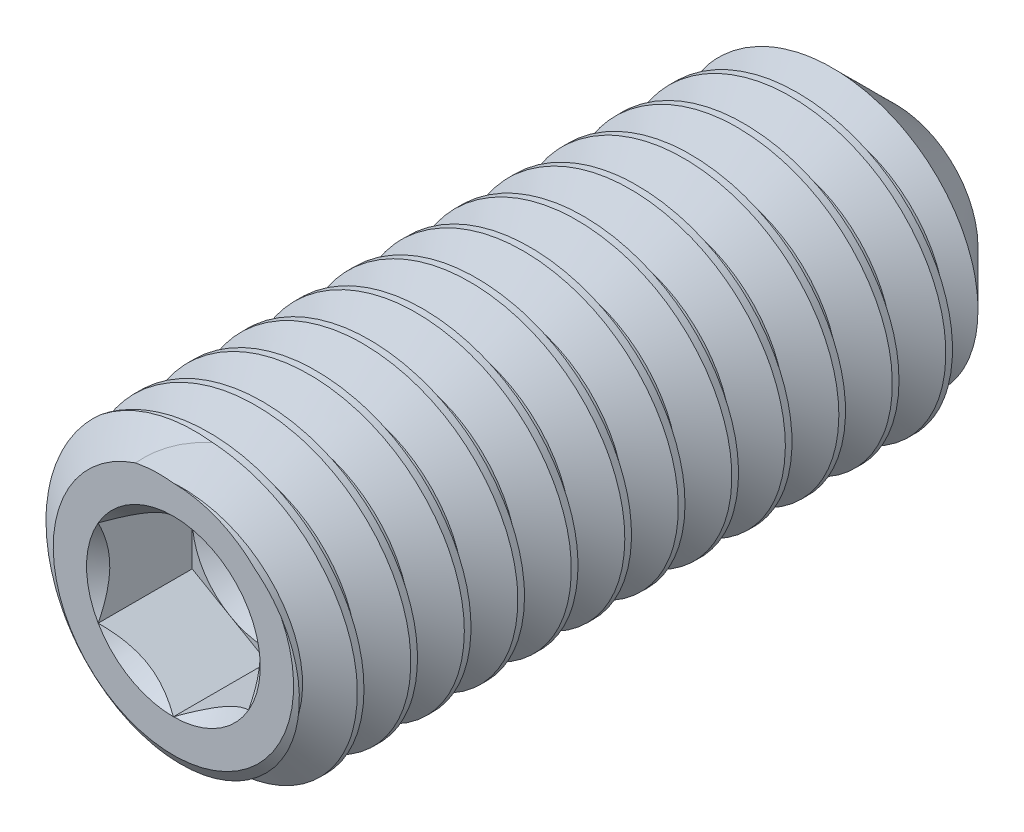
from build123d import *

# Parameters (mm, degrees)
CUT_EXTRUDE10_DEPTH = 2.48046875
CUT_SWEEP1_PITCH    = 1.411111111


with BuildPart() as part:
    # Sketch22 → Revolve1 (revolve)
    with BuildSketch(Plane(origin=(0, 0, 0), x_dir=(0, 0, -1), z_dir=(1, 0, 0)), mode=Mode.PRIVATE) as revolve1_sk:
        Polygon((-8.872688844, 0), (-8.872688844, 3.16992), (-8.317788375, 3.9624), (8.3861673, 3.9624), (10.177311156, 2.171256145), (8.872688844, 0), align=None)
    revolve(revolve1_sk.sketch.rotate(Axis((0, 0, -8.872688844), (0, 0, -1)), 180), axis=Axis((0, 0, -8.872688844), (0, 0, -1)))

    # Sketch23 → Cut-Extrude10 (cut)
    with BuildSketch(Plane.XY.offset(8.872688844)):
        Polygon((0, 2.291358881), (-1.984375, 1.14567944), (-1.984375, -1.14567944), (0, -2.291358881), (1.984375, -1.14567944), (1.984375, 1.14567944), align=None)
    extrude(amount=-CUT_EXTRUDE10_DEPTH, mode=Mode.SUBTRACT)

    # Cut-Extrude11 cone 1 section (through the dimple's axis) → Cut-Extrude11 (revolve, cut)
    with BuildSketch(Plane(origin=(0, 0, 8.872688844), x_dir=(0, -1, 0), z_dir=(1, 0, 0))):
        Polygon((0, 0), (2.291358881, 0), (0, 2.291358881), align=None)
    revolve(axis=Axis((0, 0, 8.872688844), (0, 0, -1)), mode=Mode.SUBTRACT)

    # Cut-Extrude12 cone 1 section (through the dimple's axis) → Cut-Extrude12 (revolve, cut)
    with BuildSketch(Plane(origin=(0, 0, 6.392220094), x_dir=(0, -1, 0), z_dir=(1, 0, 0))):
        Polygon((0, 0), (1.984375, 0), (0, 1.14567944), align=None)
    revolve(axis=Axis((0, 0, 6.392220094), (0, 0, -1)), mode=Mode.SUBTRACT)

    # Cut-Sweep1: the profile of Sketch32 screwed along a right-hand helix of 14.5 turns, 8 arcs to a turn; built about Z, then put on its axis
    cut_sweep1_z = Axis((0, 0, 0), (0, 0, 1))
    cut_sweep1_corners = [(3.045856448, 0, -0.529166667), (3.045856448, 0, -0.705555556), (4.038778629, 0, -1.278819444), (4.038778629, 0, 0.044097222)]
    with BuildLine(mode=Mode.PRIVATE) as cut_sweep1_profile:
        Line(cut_sweep1_corners[0], cut_sweep1_corners[1])
        Line(cut_sweep1_corners[1], cut_sweep1_corners[2])
        Line(cut_sweep1_corners[2], cut_sweep1_corners[3])
        Line(cut_sweep1_corners[3], cut_sweep1_corners[0])
    cut_sweep1_cap = Face(cut_sweep1_profile.wire())
    cut_sweep1_turn_angles = [0, 22.5, 45, 67.5, 90, 112.5, 135, 157.5, 180, 202.5, 225, 247.5, 270, 292.5, 315, 337.5, 360]
    cut_sweep1_turn_weights = [1, 0.9238795325112867, 1, 0.9238795325112867, 1, 0.9238795325112867, 1, 0.9238795325112867, 1, 0.9238795325112867, 1, 0.9238795325112867, 1, 0.9238795325112867, 1, 0.9238795325112867, 1]
    cut_sweep1_turn_rails = [Edge.make_bspline([Vector(p[0], p[1], 0).rotate(cut_sweep1_z, cut_sweep1_turn_angles[k]) / cut_sweep1_turn_weights[k] + Vector(0, 0, p[2] + CUT_SWEEP1_PITCH * cut_sweep1_turn_angles[k] / 360) for k in range(17)], [0, 0, 0, 1, 1, 2, 2, 3, 3, 4, 4, 5, 5, 6, 6, 7, 7, 8, 8, 8], 2, cut_sweep1_turn_weights) for p in cut_sweep1_corners]
    cut_sweep1_turn_sides = [Face.make_surface_from_curves(cut_sweep1_turn_rails[p[0]], cut_sweep1_turn_rails[p[1]]) for p in [(0, 1), (1, 2), (2, 3), (3, 0)]]
    cut_sweep1_last_angles = [5040, 5062.5, 5085, 5107.5, 5130, 5152.5, 5175, 5197.5, 5220]
    cut_sweep1_last_weights = [1, 0.9238795325112867, 1, 0.9238795325112867, 1, 0.9238795325112867, 1, 0.9238795325112169, 1]
    cut_sweep1_last_rails = [Edge.make_bspline([Vector(p[0], p[1], 0).rotate(cut_sweep1_z, cut_sweep1_last_angles[k]) / cut_sweep1_last_weights[k] + Vector(0, 0, p[2] + CUT_SWEEP1_PITCH * cut_sweep1_last_angles[k] / 360) for k in range(9)], [0, 0, 0, 1, 1, 2, 2, 3, 3, 4, 4, 4], 2, cut_sweep1_last_weights) for p in cut_sweep1_corners]
    cut_sweep1_last_sides = [Face.make_surface_from_curves(cut_sweep1_last_rails[p[0]], cut_sweep1_last_rails[p[1]]) for p in [(0, 1), (1, 2), (2, 3), (3, 0)]]
    cut_sweep1 = Plane(origin=(0, 0, -10.177311156), x_dir=(0, 1, 0), z_dir=(0, 0, 1)) * Solid(Shell([*[p.moved(Location((0, 0, CUT_SWEEP1_PITCH * i))) for i in range(14) for p in cut_sweep1_turn_sides], *cut_sweep1_last_sides, cut_sweep1_cap, cut_sweep1_cap.rotate(cut_sweep1_z, 5220).moved(Location((0, 0, CUT_SWEEP1_PITCH * 5220 / 360)))]))
    add(cut_sweep1, mode=Mode.SUBTRACT)


solid = part.part
